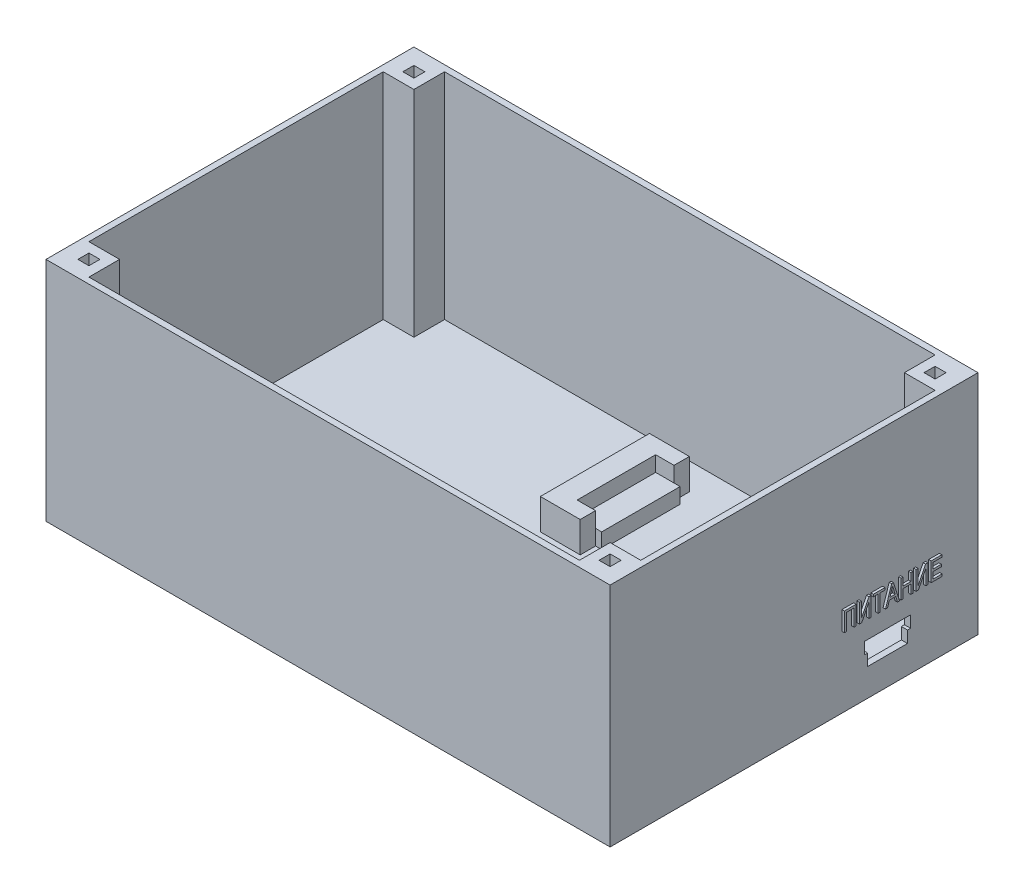
from build123d import *

# Parameters (mm, degrees)
SKETCH_2_W          = 92
SKETCH_2_H          = 60
EXTRUDE_1_DEPTH     = 2
SKETCH_14_W         = 92
SKETCH_14_H         = 60
SKETCH_14_W_2       = 90
SKETCH_14_H_2       = 58
EXTRUDE_9_DEPTH     = 35
SKETCH_18_W         = 4
SKETCH_18_H         = 12.8
EXTRUDE_12_DEPTH    = 2.5
SKETCH_19_W         = 3
SKETCH_19_H         = 2.5
EXTRUDE_13_DEPTH    = 5
SKETCH_20_W         = 3.5
SKETCH_20_H         = 17.8
EXTRUDE_14_DEPTH    = 5
CUT_EXTRUDE_1_DEPTH = 5
SKETCH_21_W         = 2.706084524
SKETCH_21_H         = 20.3
EXTRUDE_16_DEPTH    = 2.5
SKETCH_22_W         = 2.706084524
SKETCH_22_H         = 2.5
EXTRUDE_17_DEPTH    = 5
SKETCH_16_W         = 5
SKETCH_16_H         = 5
SKETCH_16_W_2       = 1.8
SKETCH_16_H_2       = 1.8
EXTRUDE_19_DEPTH    = 35
EXTRUDE_20_DEPTH    = 0.4


with BuildPart() as part:
    # Эскиз2 → Бобышка-Вытянуть1 (new body)
    with BuildSketch(Plane(origin=(0, 0, 0), x_dir=(1, 0, 0), z_dir=(0, 1, 0))):
        with Locations((46, 30)):
            Rectangle(SKETCH_2_W, SKETCH_2_H)
    extrude(amount=EXTRUDE_1_DEPTH)



with BuildPart() as body_2:
    # Эскиз14 → Бобышка-Вытянуть9 (new body)
    with BuildSketch(Plane(origin=(0, 2, 0), x_dir=(1, 0, 0), z_dir=(0, 1, 0))):
        with Locations((46, 30)):
            Rectangle(SKETCH_14_W, SKETCH_14_H)
        with Locations((46, 30)):
            Rectangle(SKETCH_14_W_2, SKETCH_14_H_2, mode=Mode.SUBTRACT)
    extrude(amount=EXTRUDE_9_DEPTH)


with BuildPart() as part_1:
    add(part.part)

    add(body_2.part)  # Бобышка-Вытянуть12 merges body 2
    # Эскиз18 → Бобышка-Вытянуть12 (add)
    with BuildSketch(Plane(origin=(0, 2, 0), x_dir=(1, 0, 0), z_dir=(0, 1, 0))):
        with Locations((49.3, 45.72407939)):
            Rectangle(SKETCH_18_W, SKETCH_18_H)
    extrude(amount=EXTRUDE_12_DEPTH)

    # Эскиз19 → Бобышка-Вытянуть13 (add)
    with BuildSketch(Plane(origin=(0, 2, 0), x_dir=(1, 0, 0), z_dir=(0, 1, 0))):
        with Locations((48.8, 38.07407939)):
            Rectangle(SKETCH_19_W, SKETCH_19_H)
        with Locations((48.8, 53.37407939)):
            Rectangle(SKETCH_19_W, SKETCH_19_H)
    extrude(amount=EXTRUDE_13_DEPTH)

    # Эскиз20 → Бобышка-Вытянуть14 (add)
    with BuildSketch(Plane(origin=(0, 2, 0), x_dir=(1, 0, 0), z_dir=(0, 1, 0))):
        with Locations((45.55, 45.72407939)):
            Rectangle(SKETCH_20_W, SKETCH_20_H)
    extrude(amount=EXTRUDE_14_DEPTH)

    # Эскиз17 → Вырез-Вытянуть1 (cut)
    with BuildSketch(Plane(origin=(92, 0, 0), x_dir=(0, 0, -1), z_dir=(1, 0, 0))):
        Polygon((41.5, 8.3), (49, 8.3), (49, 6.4), (48.5, 6.4), (48.5, 4.5), (42, 4.5), (42, 6.4), (41.5, 6.4), align=None)
    extrude(amount=-CUT_EXTRUDE_1_DEPTH, mode=Mode.SUBTRACT)

    # Эскиз21 → Бобышка-Вытянуть16 (add)
    with BuildSketch(Plane(origin=(0, 2, 0), x_dir=(1, 0, 0), z_dir=(0, 1, 0))):
        with Locations((2.353042262, 16.15)):
            Rectangle(SKETCH_21_W, SKETCH_21_H)
        with Locations((89.646957738, 16.15)):
            Rectangle(SKETCH_21_W, SKETCH_21_H)
    extrude(amount=EXTRUDE_16_DEPTH)

    # Эскиз22 → Бобышка-Вытянуть17 (add)
    with BuildSketch(Plane(origin=(0, 2, 0), x_dir=(1, 0, 0), z_dir=(0, 1, 0))):
        with Locations((2.353042262, 27.55)):
            Rectangle(SKETCH_22_W, SKETCH_22_H)
        with Locations((89.646957738, 27.55)):
            Rectangle(SKETCH_22_W, SKETCH_22_H)
    extrude(amount=EXTRUDE_17_DEPTH)

    # Эскиз16 → Бобышка-Вытянуть19 (add)
    # profile 1 of 4: a face of its own
    with BuildSketch(Plane(origin=(0, 2, 0), x_dir=(1, 0, 0), z_dir=(0, 1, 0))):
        with Locations((3.5, 56.5)):
            Rectangle(SKETCH_16_W, SKETCH_16_H)
        with Locations((3.5, 56.5)):
            Rectangle(SKETCH_16_W_2, SKETCH_16_H_2, mode=Mode.SUBTRACT)
    # profile 2 of 4: a face of its own
    with BuildSketch(Plane(origin=(0, 2, 0), x_dir=(1, 0, 0), z_dir=(0, 1, 0))):
        with Locations((88.5, 3.5)):
            Rectangle(SKETCH_16_W, SKETCH_16_H)
        with Locations((88.5, 3.5)):
            Rectangle(SKETCH_16_W_2, SKETCH_16_H_2, mode=Mode.SUBTRACT)
    # profile 3 of 4: a face of its own
    with BuildSketch(Plane(origin=(0, 2, 0), x_dir=(1, 0, 0), z_dir=(0, 1, 0))):
        with Locations((3.5, 3.5)):
            Rectangle(SKETCH_16_W, SKETCH_16_H)
        with Locations((3.5, 3.5)):
            Rectangle(SKETCH_16_W_2, SKETCH_16_H_2, mode=Mode.SUBTRACT)
    # profile 4 of 4: a face of its own
    with BuildSketch(Plane(origin=(0, 2, 0), x_dir=(1, 0, 0), z_dir=(0, 1, 0))):
        with Locations((88.5, 56.5)):
            Rectangle(SKETCH_16_W, SKETCH_16_H)
        with Locations((88.5, 56.5)):
            Rectangle(SKETCH_16_W_2, SKETCH_16_H_2, mode=Mode.SUBTRACT)
    extrude(amount=EXTRUDE_19_DEPTH)

    # Эскиз23 → Бобышка-Вытянуть20 (add)
    # profile 1 of 7: a face of its own
    with BuildSketch(Plane(origin=(92, 0, 0), x_dir=(0, 0, -1), z_dir=(1, 0, 0))):
        Polygon((37.820297464, 14.633638566), (39.716902031, 14.633638566), (39.716902031, 11.551656144), (39.40080127, 11.551656144), (39.40080127, 14.278025209), (38.136398225, 14.278025209), (38.136398225, 11.551656144), (37.820297464, 11.551656144), align=None)
    # profile 2 of 7: a face of its own
    with BuildSketch(Plane(origin=(92, 0, 0), x_dir=(0, 0, -1), z_dir=(1, 0, 0))):
        Polygon((40.270078363, 14.633638566), (40.586179124, 14.633638566), (40.586179124, 12.193118431), (41.807982653, 14.633638566), (42.166682931, 14.633638566), (42.166682931, 11.551656144), (41.850582169, 11.551656144), (41.850582169, 13.986002436), (40.631248178, 11.551656144), (40.270078363, 11.551656144), align=None)
    # profile 3 of 7: a face of its own
    with BuildSketch(Plane(origin=(92, 0, 0), x_dir=(0, 0, -1), z_dir=(1, 0, 0))):
        Polygon((43.31254819, 11.551656144), (43.31254819, 14.278025209), (42.522296287, 14.278025209), (42.522296287, 14.633638566), (44.418900854, 14.633638566), (44.418900854, 14.278025209), (43.628648951, 14.278025209), (43.628648951, 11.551656144), align=None)
    # profile 4 of 7: a face of its own
    with BuildSketch(Plane(origin=(92, 0, 0), x_dir=(0, 0, -1), z_dir=(1, 0, 0))):
        Polygon((44.516447573, 11.551656144), (45.514757985, 14.633638566), (45.812954602, 14.633638566), (46.811265014, 11.551656144), (46.473555802, 11.551656144), (46.192028562, 12.499958427), (45.135066641, 12.499958427), (44.853539401, 11.551656144), align=None)
        with BuildLine():
            Line((45.240639357, 12.855571784), (46.086455846, 12.855571784))
            Line((46.086455846, 12.855571784), (45.84567597, 13.664345216))
            add(Edge.make_bspline(
                [(45.84567597, 13.664345216), (45.836426209, 13.695629271), (45.81840739, 13.756571573), (45.791917269, 13.845492472), (45.766358364, 13.929527401), (45.743018253, 14.008795057), (45.721701904, 14.083295859), (45.700236272, 14.152384308), (45.681371857, 14.216880949), (45.669307011, 14.258268151), (45.663547602, 14.278025209)],
                knots=[0, 0, 0, 0, 1.223089462, 2.382615935, 3.47858657, 4.516186366, 5.480638401, 6.383728134, 7.228438372, 8, 8, 8, 8], degree=3))
            add(Edge.make_bspline(
                [(45.663547602, 14.278025209), (45.635377776, 14.18294088), (45.578724644, 13.9917141), (45.521779603, 13.800574044), (45.493149535, 13.704475195)],
                knots=[0, 0, 0, 0, 0.994466669, 2, 2, 2, 2], degree=3))
            Line((45.493149535, 13.704475195), (45.240639357, 12.855571784))
        make_face(mode=Mode.SUBTRACT)
    # profile 5 of 7: a face of its own
    with BuildSketch(Plane(origin=(92, 0, 0), x_dir=(0, 0, -1), z_dir=(1, 0, 0))):
        Polygon((47.066244729, 11.551656144), (47.066244729, 14.633638566), (47.382345491, 14.633638566), (47.382345491, 13.369235521), (48.646748535, 13.369235521), (48.646748535, 14.633638566), (48.962849297, 14.633638566), (48.962849297, 11.551656144), (48.646748535, 11.551656144), (48.646748535, 13.013622164), (47.382345491, 13.013622164), (47.382345491, 11.551656144), align=None)
    # profile 6 of 7: a face of its own
    with BuildSketch(Plane(origin=(92, 0, 0), x_dir=(0, 0, -1), z_dir=(1, 0, 0))):
        Polygon((49.516025629, 14.633638566), (49.83212639, 14.633638566), (49.83212639, 12.193118431), (51.053929918, 14.633638566), (51.412630196, 14.633638566), (51.412630196, 11.551656144), (51.096529435, 11.551656144), (51.096529435, 13.986002436), (49.877195444, 11.551656144), (49.516025629, 11.551656144), align=None)
    # profile 7 of 7: a face of its own
    with BuildSketch(Plane(origin=(92, 0, 0), x_dir=(0, 0, -1), z_dir=(1, 0, 0))):
        Polygon((51.965806528, 11.551656144), (51.965806528, 14.633638566), (53.704360715, 14.633638566), (53.704360715, 14.278025209), (52.28190729, 14.278025209), (52.28190729, 13.329722926), (53.625335525, 13.329722926), (53.625335525, 12.974109569), (52.28190729, 12.974109569), (52.28190729, 11.9072695), (53.74387331, 11.9072695), (53.74387331, 11.551656144), align=None)
    extrude(amount=EXTRUDE_20_DEPTH)


solid = part_1.part
